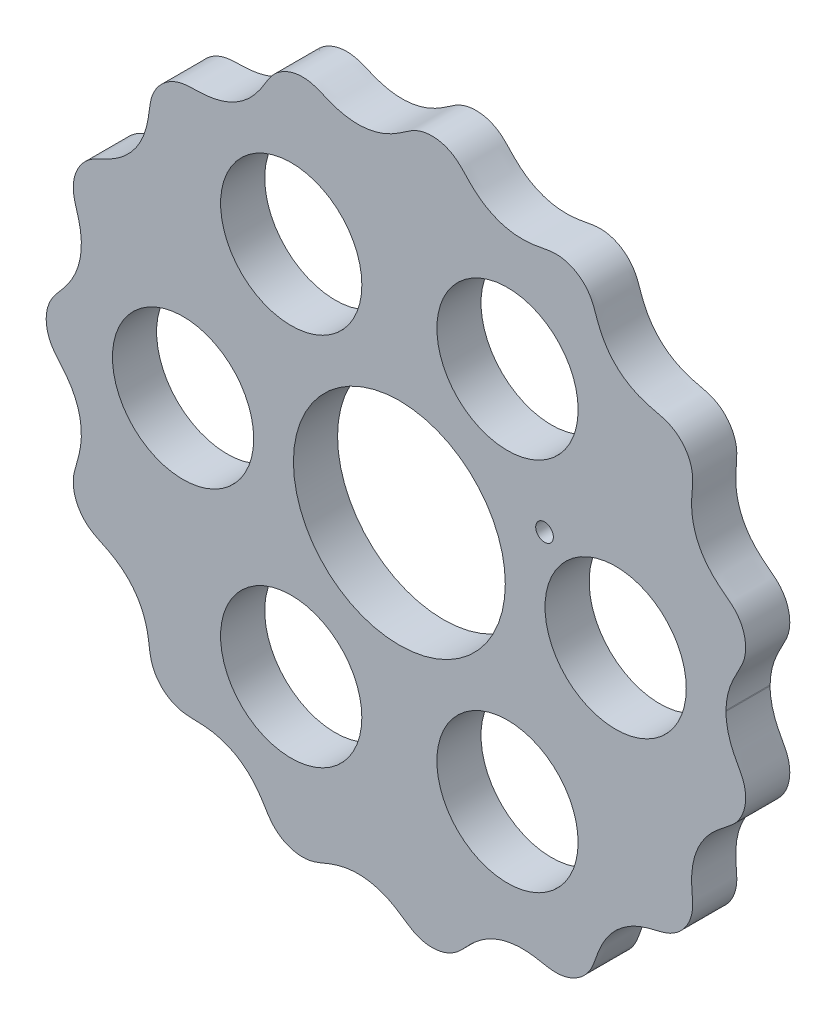
from build123d import *

# Parameters (mm, degrees)
BOSS_EXTRUDE1_DEPTH = 5
SKETCH2_R           = 12
SKETCH2_R_2         = 8
CUT_EXTRUDE1_DEPTH  = 57.653596622
SKETCH3_R           = 1
CUT_EXTRUDE2_DEPTH  = 57.653596622


# Read off the part's stored shape, not the designer's step: Boss-Extrude1
with BuildPart() as part:
    # Boss-Extrude1 outline → Boss-Extrude1 (new body)
    with BuildSketch(Plane.XY):
        with BuildLine():
            Line((36.998722033, -0.001054281), (36.99954865, 0.112257386))
            add(Edge.make_bspline(
                [(36.99954865, 0.112257386), (37.000270367, 0.161831196), (37.002853756, 0.261309148), (37.011083739, 0.475612896), (37.027751866, 0.686060064), (37.057401299, 0.973781963), (37.106377226, 1.31810626), (37.171822023, 1.656164832), (37.253267458, 1.993388321), (37.347124748, 2.325846439), (37.452941361, 2.655441957), (37.593357547, 3.033759794), (37.800770534, 3.51967602), (38.063070944, 4.054128866), (38.380004735, 4.635374121), (38.732518387, 5.273630146), (39.046751238, 6.008512211), (39.236640726, 6.858055977), (39.250091521, 7.787066394), (39.053564794, 8.75531068), (38.626208159, 9.732695543), (38.025700448, 10.517383756), (37.328054136, 11.091682662), (36.60811715, 11.629850376), (35.975000223, 12.138034306), (35.152550193, 12.91020298), (34.390673897, 13.870253643), (33.789981735, 14.95868362), (33.378085782, 16.145067451), (33.169373356, 17.154843178), (33.092097624, 18.112108135), (33.108904916, 19.000648259), (33.173614, 19.815733524), (33.238879281, 20.560019274), (33.227987247, 21.380129686), (33.047104395, 22.255228109), (32.664665017, 23.127768358), (32.06507968, 23.941852005), (31.23982104, 24.668864946), (30.167791626, 25.209669724), (29.000711136, 25.434830102), (27.857662069, 25.733478365), (26.84322374, 26.116856655), (25.973167428, 26.568653448), (25.160139265, 27.123784444), (24.422495656, 27.779104005), (23.770727885, 28.523846991), (23.215457794, 29.345954056), (22.792691619, 30.162245603), (22.47390955, 30.945683354), (22.219346682, 31.675325555), (21.987533976, 32.336511026), (21.659745235, 33.038802347), (21.169269169, 33.733285134), (20.490527161, 34.370384852), (19.62184838, 34.886918222), (18.721124416, 35.182924139), (17.841990931, 35.279542311), (17.032588114, 35.215325385), (16.30577961, 35.076867908), (15.510727511, 34.926325841), (14.638426571, 34.811573208), (13.688649268, 34.778978993), (12.671565392, 34.867723121), (11.447844853, 35.135462468), (10.292384973, 35.604508144), (9.244164008, 36.252478247), (8.244380121, 37.098840325), (7.447178549, 37.929698394), (6.674634431, 38.793502658), (5.68309281, 39.41558352), (4.66819347, 39.747034623), (3.692809843, 39.849081483), (2.630366398, 39.734817039), (1.530382972, 39.330180269), (0.594362483, 38.643900587), (-0.359798631, 37.997102241), (-1.301372389, 37.49269138), (-2.206771749, 37.131336425), (-3.161399566, 36.878076), (-4.150113917, 36.746090347), (-5.159112151, 36.741723073), (-6.170393876, 36.868024154), (-7.091417923, 37.098213056), (-7.919228397, 37.39230107), (-8.664576462, 37.704746935), (-9.345935181, 37.990582819), (-10.123662642, 38.220232855), (-11.002600535, 38.307242073), (-11.9445112, 38.204102119), (-12.901325323, 37.878615217), (-13.697734929, 37.395441616), (-14.321962314, 36.816489383), (-14.788333399, 36.196222631), (-15.15271525, 35.596738144), (-15.55423565, 34.935241327), (-16.030244773, 34.234700168), (-16.61524447, 33.523916779), (-17.33141745, 32.835420988), (-18.125443708, 32.24348686), (-18.984145093, 31.7575464), (-19.894861635, 31.385470152), (-20.838888358, 31.12642101), (-21.909595088, 30.963786363), (-23.088125921, 30.910663697), (-24.274994516, 30.932065517), (-25.434031129, 30.62446242), (-26.389157903, 30.085624441), (-27.141333946, 29.416783184), (-27.69727162, 28.643752428), (-28.058710579, 27.822059835), (-28.241105604, 27.01230335), (-28.332549336, 26.255181748), (-28.441352124, 25.435207729), (-28.613815275, 24.559922927), (-28.892199166, 23.643549075), (-29.306598206, 22.709052047), (-29.95580069, 21.642454051), (-30.768114001, 20.708833865), (-31.711629586, 19.931800273), (-32.675790022, 19.349849993), (-33.40030725, 18.98501049), (-34.214746578, 18.609763984), (-35.229470131, 18.07968265), (-36.114733026, 17.200706168), (-36.720075728, 16.030293846), (-36.984206131, 14.73501705), (-36.921436836, 13.540326839), (-36.536844923, 12.419312831), (-36.222064605, 11.285126273), (-36.044759387, 10.218808333), (-35.997118214, 9.243188269), (-36.067290528, 8.262910288), (-36.261191486, 7.295472475), (-36.577234742, 6.355849135), (-37.0088699, 5.458795345), (-37.599558744, 4.532516269), (-38.243938105, 3.735290386), (-38.885916528, 3.033020611), (-39.436551465, 2.254140701), (-39.796055658, 1.48046551), (-40.011497212, 0.573417452), (-40.026612923, -0.437283008), (-39.83543547, -1.364356277), (-39.483345482, -2.1726004), (-39.027053396, -2.841063846), (-38.546053167, -3.400176958), (-38.019306876, -4.011037517), (-37.4839594, -4.705445769), (-36.9799451, -5.507802007), (-36.546140169, -6.427806197), (-36.236329623, -7.387083398), (-36.053781782, -8.367659532), (-35.997037565, -9.354790726), (-36.059079888, -10.329485057), (-36.246239764, -11.38357784), (-36.566424081, -12.493071312), (-36.931379346, -13.597775621), (-36.980703376, -14.770029814), (-36.710370557, -16.057740558), (-36.09410814, -17.230756), (-35.067609609, -18.228819967), (-33.784970318, -18.798452451), (-32.751396611, -19.29632661), (-31.637911457, -19.983115099), (-30.501762392, -20.94144115), (-29.575814047, -22.135732199), (-28.925964108, -23.50281001), (-28.590028762, -24.66344732), (-28.428347132, -25.52966679), (-28.325131449, -26.334004858), (-28.232745376, -27.069385325), (-28.045129505, -27.860973503), (-27.682554734, -28.669502504), (-27.123409006, -29.436271159), (-26.364707126, -30.103880562), (-25.550537644, -30.553425904), (-24.740620095, -30.806480973), (-23.97308253, -30.902740914), (-23.273939358, -30.919490682), (-22.502855754, -30.935753534), (-21.660848761, -30.995699397), (-20.755458968, -31.143633919), (-19.803336359, -31.415038945), (-18.893624774, -31.802079177), (-18.041061706, -32.298846798), (-17.25961325, -32.899231861), (-16.557986937, -33.586951826), (-15.877270869, -34.433905919), (-15.237275543, -35.42990474), (-14.662795523, -36.472993139), (-13.817758148, -37.329214514), (-12.870992683, -37.89144908), (-11.91204679, -38.211565908), (-10.964987774, -38.307049033), (-10.078357726, -38.210724198), (-9.295914268, -37.96984607), (-8.609229525, -37.678839537), (-7.8557317, -37.365570415), (-7.017669629, -37.074469353), (-6.085831103, -36.850873928), (-5.062752273, -36.735276131), (-3.808276519, -36.757214235), (-2.585154279, -36.989126891), (-1.436131485, -37.415006627), (-0.296689553, -38.037508647), (0.643436405, -38.683822821), (1.575687506, -39.355623169), (2.669397264, -39.742606598), (3.723806861, -39.848834564), (4.694097873, -39.740195807), (5.715557522, -39.401367705), (6.720324277, -38.755118722), (7.656439553, -37.683960891), (8.83657926, -36.512961786), (10.161723139, -35.644794212), (11.538286303, -35.108041682), (12.750288343, -34.857416342), (13.745574669, -34.779578069), (14.670794337, -34.816123496), (15.514541118, -34.928897433), (16.279136012, -35.072817118), (16.971564564, -35.205288227), (17.748142508, -35.278608078), (18.600989485, -35.206427359), (19.496372698, -34.940981685), (20.380385726, -34.451026121), (21.088226956, -33.824538987), (21.612792464, -33.119704651), (21.96521667, -32.393866486), (22.209201019, -31.700415058), (22.47336021, -30.940939076), (22.80406093, -30.132196479), (23.243053928, -29.295611883), (23.817496134, -28.460842401), (24.649676677, -27.531606055), (25.809747588, -26.610264213), (27.225978407, -25.902033944), (28.82566442, -25.471890962), (30.216326183, -25.19491269), (31.272650701, -24.645093521), (32.073667779, -23.929645469), (32.650932336, -23.142109086), (33.084816806, -22.173026821), (33.292673149, -21.027507985), (33.173363035, -19.880870911), (33.085925414, -18.739242734), (33.120199423, -17.436854068), (33.33141262, -16.227060355), (33.747552539, -15.052890892), (34.360355928, -13.958928795), (34.973244187, -13.13577506), (35.6329212, -12.444924412), (36.303323804, -11.868151838), (36.949747372, -11.374502376), (37.542926334, -10.926101731), (38.138564068, -10.36834062), (38.661644623, -9.649469585), (39.051622501, -8.775534009), (39.253528668, -7.771627681), (39.232399083, -6.819885719), (39.03171435, -5.963997917), (38.706407116, -5.225345417), (38.348390806, -4.582262366), (38.030274513, -3.994030786), (37.768638219, -3.452599851), (37.563114133, -2.959998795), (37.424791209, -2.576230778), (37.321329499, -2.242346894), (37.245350457, -1.961010862), (37.19102617, -1.734632017), (37.143162747, -1.506409484), (37.101957025, -1.276429983), (37.067473649, -1.048557704), (37.039794321, -0.812504101), (37.021586593, -0.61210125), (37.010300225, -0.444046604), (37.002482905, -0.262758267), (36.999587895, -0.126805105), (36.998720424, -0.051157403), (36.998722033, -0.001054281)],
                knots=[0.069906552, 0.069906552, 0.069906552, 0.069906552, 0.069906552, 0.070662705, 0.071418858, 0.072175011, 0.072931163, 0.074443469, 0.075955774, 0.076711927, 0.07746808, 0.078980385, 0.08049269, 0.082004996, 0.084395977, 0.086786958, 0.08917794, 0.091568921, 0.094847068, 0.098125216, 0.101274746, 0.104424276, 0.108751929, 0.110915756, 0.113079582, 0.116233921, 0.119388259, 0.125696936, 0.129069551, 0.132442167, 0.135814782, 0.139187398, 0.141638114, 0.144088829, 0.146539545, 0.148990261, 0.152358337, 0.155726414, 0.158934823, 0.162143232, 0.166691212, 0.171239193, 0.174449338, 0.177659484, 0.18086963, 0.184079776, 0.187325474, 0.190571172, 0.19381687, 0.197062568, 0.199360109, 0.20165765, 0.203955191, 0.206252732, 0.209495427, 0.212738122, 0.216072123, 0.219406124, 0.221832132, 0.224258141, 0.226684149, 0.229110158, 0.23244866, 0.235787163, 0.239125665, 0.242464168, 0.248842239, 0.252031274, 0.25522031, 0.259595681, 0.263971051, 0.267155181, 0.270339311, 0.273527927, 0.276716543, 0.281098028, 0.285479514, 0.288672977, 0.291866441, 0.295059905, 0.298253368, 0.301587487, 0.304921605, 0.308255723, 0.311589842, 0.314012663, 0.316435485, 0.318858306, 0.321281127, 0.324610812, 0.327940497, 0.331187646, 0.334434795, 0.336735333, 0.339035871, 0.341336408, 0.343636946, 0.346887177, 0.350137408, 0.35338764, 0.356637871, 0.35984345, 0.363049029, 0.366254608, 0.369460188, 0.374002159, 0.37854413, 0.381748168, 0.384952206, 0.388295162, 0.391638118, 0.394139738, 0.396641357, 0.399142977, 0.401644597, 0.404988572, 0.408332548, 0.411676523, 0.415020498, 0.421320268, 0.424470152, 0.427620037, 0.42978082, 0.431941604, 0.436263171, 0.442553477, 0.44575116, 0.448948842, 0.4534821, 0.458015359, 0.461214295, 0.464413231, 0.467612167, 0.470811103, 0.474067915, 0.477324728, 0.48058154, 0.483838353, 0.488448153, 0.490753054, 0.493057954, 0.496311571, 0.499565188, 0.502888593, 0.506211997, 0.508630191, 0.511048385, 0.513466578, 0.515884772, 0.519212512, 0.522540252, 0.525867992, 0.529195732, 0.532395625, 0.535595519, 0.538795412, 0.541995305, 0.546385703, 0.5507761, 0.553971235, 0.55716637, 0.563521587, 0.567888097, 0.572254606, 0.575437202, 0.578619797, 0.584984988, 0.59167472, 0.595019587, 0.598364453, 0.600795097, 0.603225741, 0.605656385, 0.608087029, 0.611427296, 0.614767562, 0.618003803, 0.621240044, 0.623533226, 0.625826408, 0.628119589, 0.630412771, 0.633651874, 0.636890977, 0.640130079, 0.643369182, 0.646585958, 0.649802734, 0.65301951, 0.656236286, 0.66079302, 0.665349754, 0.668564511, 0.671779268, 0.67514097, 0.678502671, 0.680948815, 0.683394958, 0.685841102, 0.688287245, 0.691653534, 0.695019824, 0.698386113, 0.701752402, 0.708074014, 0.711234819, 0.714395625, 0.718732153, 0.723068681, 0.726224574, 0.729380466, 0.732567413, 0.73575436, 0.740272967, 0.744791574, 0.751166985, 0.757542395, 0.760810298, 0.764078201, 0.767346103, 0.770614006, 0.772926291, 0.775238576, 0.777550861, 0.779863146, 0.783127665, 0.786392183, 0.789704968, 0.793017752, 0.795428146, 0.79783854, 0.800248934, 0.802659328, 0.805976281, 0.809293235, 0.812610189, 0.815927142, 0.82228005, 0.828632958, 0.833136991, 0.837641023, 0.840817225, 0.843993427, 0.847160094, 0.850326761, 0.854678316, 0.859029872, 0.862201581, 0.86537329, 0.871716709, 0.875072299, 0.878427889, 0.881783479, 0.88513907, 0.887577489, 0.890015909, 0.892454329, 0.894892749, 0.898243686, 0.901594623, 0.904905775, 0.908216926, 0.910631245, 0.913045564, 0.915459883, 0.917874201, 0.919402492, 0.920930783, 0.922459074, 0.923223219, 0.923987364, 0.92475151, 0.925515655, 0.9262798, 0.927043946, 0.927808091, 0.928572236, 0.928954309, 0.929336382, 0.930100527, 0.930100527, 0.930100527, 0.930100527, 0.930100527], degree=4))
        make_face()
    extrude(amount=BOSS_EXTRUDE1_DEPTH)

    # Sketch2 → Cut-Extrude1 (cut, through all)
    with BuildSketch(Plane.XY.offset(5)):
        Circle(SKETCH2_R)
        with Locations((24.499360993, -0.001054281)):
            Circle(SKETCH2_R_2)
        with Locations((12.248767462, -21.217596137)):
            Circle(SKETCH2_R_2)
        with Locations((-12.250593531, -21.216541856)):
            Circle(SKETCH2_R_2)
        with Locations((-24.499360993, 0.001054281)):
            Circle(SKETCH2_R_2)
        with Locations((-12.248767462, 21.217596137)):
            Circle(SKETCH2_R_2)
        with Locations((12.250593531, 21.216541856)):
            Circle(SKETCH2_R_2)
    extrude(amount=-CUT_EXTRUDE1_DEPTH, mode=Mode.SUBTRACT)

    # Sketch3 → Cut-Extrude2 (cut, through all)
    with BuildSketch(Plane.XY.offset(5)):
        with Locations((16.443818238, 7.321259575)):
            Circle(SKETCH3_R)
    extrude(amount=-CUT_EXTRUDE2_DEPTH, mode=Mode.SUBTRACT)


solid = part.part
